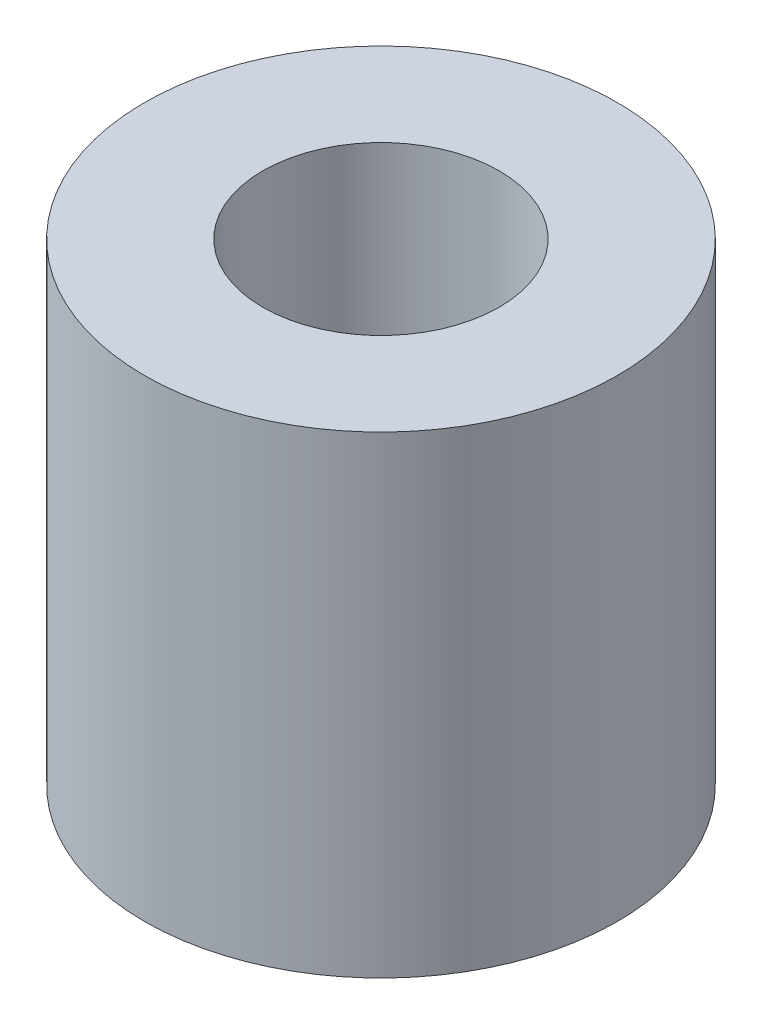
from build123d import *

# Parameters (mm, degrees)
SKETCH2_R           = 17.5
SKETCH2_R_2         = 8.75
BOSS_EXTRUDE1_DEPTH = 35


with BuildPart() as part:
    # Sketch2 → Boss-Extrude1 (new body)
    with BuildSketch(Plane(origin=(0, 0, 0), x_dir=(1, 0, 0), z_dir=(0, 1, 0))):
        Circle(SKETCH2_R)
        Circle(SKETCH2_R_2, mode=Mode.SUBTRACT)
    extrude(amount=BOSS_EXTRUDE1_DEPTH)


solid = part.part
